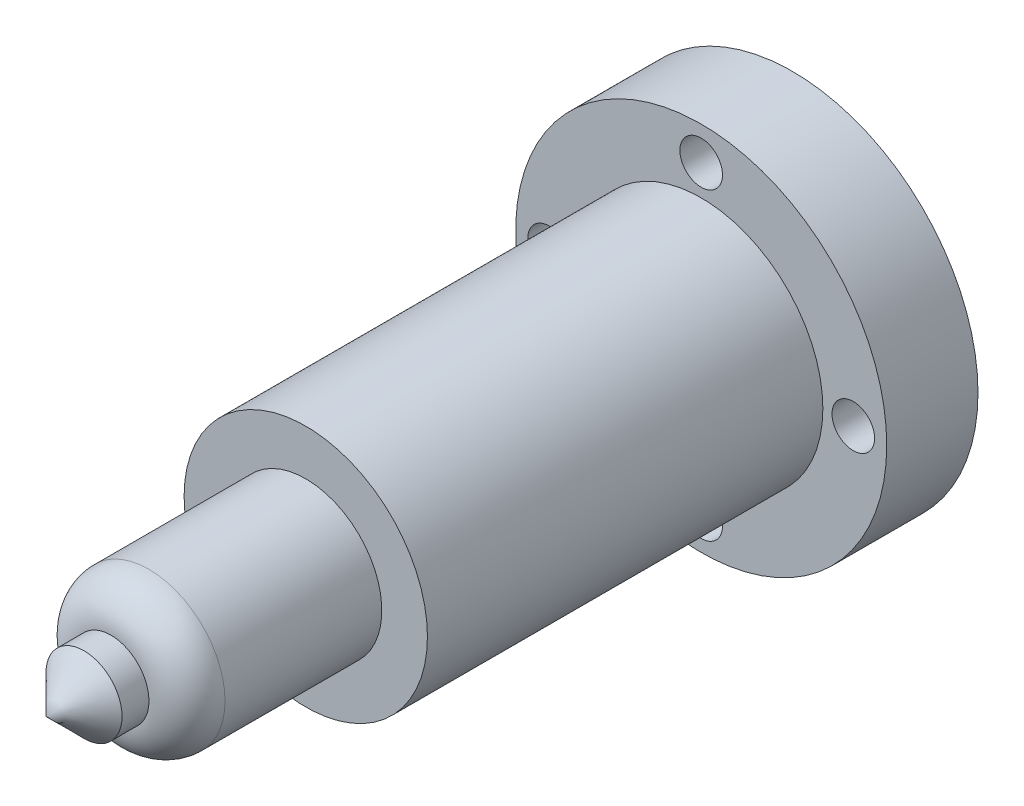
from build123d import *

# Parameters (mm, degrees)
SKETCH1_R           = 30.5
BOSS_EXTRUDE1_DEPTH = 15
SKETCH2_R           = 3.5
CUT_EXTRUDE1_DEPTH  = 15
SKETCH3_R           = 20
BOSS_EXTRUDE2_DEPTH = 65
SKETCH4_R           = 12.5
BOSS_EXTRUDE3_DEPTH = 42.7
CUT_EXTRUDE2_START  = -10.675
SKETCH5_R           = 12.5
SKETCH5_R_2         = 6.25
CUT_EXTRUDE2_DEPTH  = 10.675
FILLET1_R           = 6.25
CHAMFER1_SIZE       = 6.25


with BuildPart() as part:
    # Sketch1 → Boss-Extrude1 (new body)
    with BuildSketch(Plane.XY):
        Circle(SKETCH1_R)
    extrude(amount=BOSS_EXTRUDE1_DEPTH)

    # Sketch2 → Cut-Extrude1 (cut)
    with BuildSketch(Plane.XY.offset(15)):
        with Locations((0, 25)):
            Circle(SKETCH2_R)
        with Locations((25, 0)):
            Circle(SKETCH2_R)
        with Locations((0, -25)):
            Circle(SKETCH2_R)
        with Locations((-25, 0)):
            Circle(SKETCH2_R)
    extrude(amount=-CUT_EXTRUDE1_DEPTH, mode=Mode.SUBTRACT)

    # Sketch3 → Boss-Extrude2 (add)
    with BuildSketch(Plane.XY.offset(15)):
        Circle(SKETCH3_R)
    extrude(amount=BOSS_EXTRUDE2_DEPTH)

    # Sketch4 → Boss-Extrude3 (add)
    with BuildSketch(Plane.XY.offset(80)):
        with Locations(Location((0, 0, 0), (0, 0, 180))):
            Circle(SKETCH4_R)
    extrude(amount=BOSS_EXTRUDE3_DEPTH)

    # Sketch5 → Cut-Extrude2 (cut)
    with BuildSketch(Plane.XY.offset(122.7).offset(CUT_EXTRUDE2_START)):
        with Locations(Location((0, 0, 0), (0, 0, 180))):
            Circle(SKETCH5_R)
        Circle(SKETCH5_R_2, mode=Mode.SUBTRACT)
    extrude(amount=CUT_EXTRUDE2_DEPTH, mode=Mode.SUBTRACT)

    # Fillet1
    fillet1_edges = [part.edges().sort_by_distance(p)[0] for p in [
        (12.5, 0, 112.025),
    ]]
    fillet(fillet1_edges, radius=FILLET1_R - 0.0001)  # a hair under: the kernel refuses the full size

    # Chamfer1
    chamfer1_edges = [part.edges().sort_by_distance(p)[0] for p in [
        (-6.25, 0, 122.7),
    ]]
    chamfer(chamfer1_edges, length=CHAMFER1_SIZE)


solid = part.part
